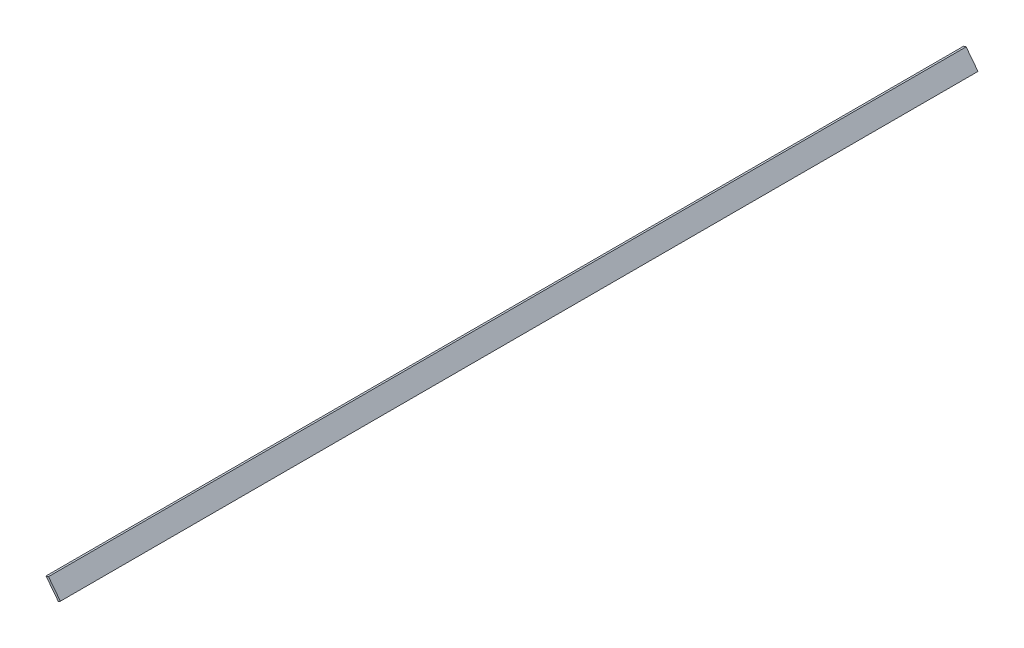
from build123d import *

# Parameters (mm, degrees)
BOSS_EXTRUDE1_DEPTH = 901.7


with BuildPart() as part:
    # Sketch1 → Boss-Extrude1 (new body)
    with BuildSketch(Plane.XY):
        Polygon((0, 0), (1.869125643, 1.444423128), (-9.802405578, 16.547724837), (-12.26983087, 15.8775189), align=None)
    extrude(amount=BOSS_EXTRUDE1_DEPTH)


solid = part.part
